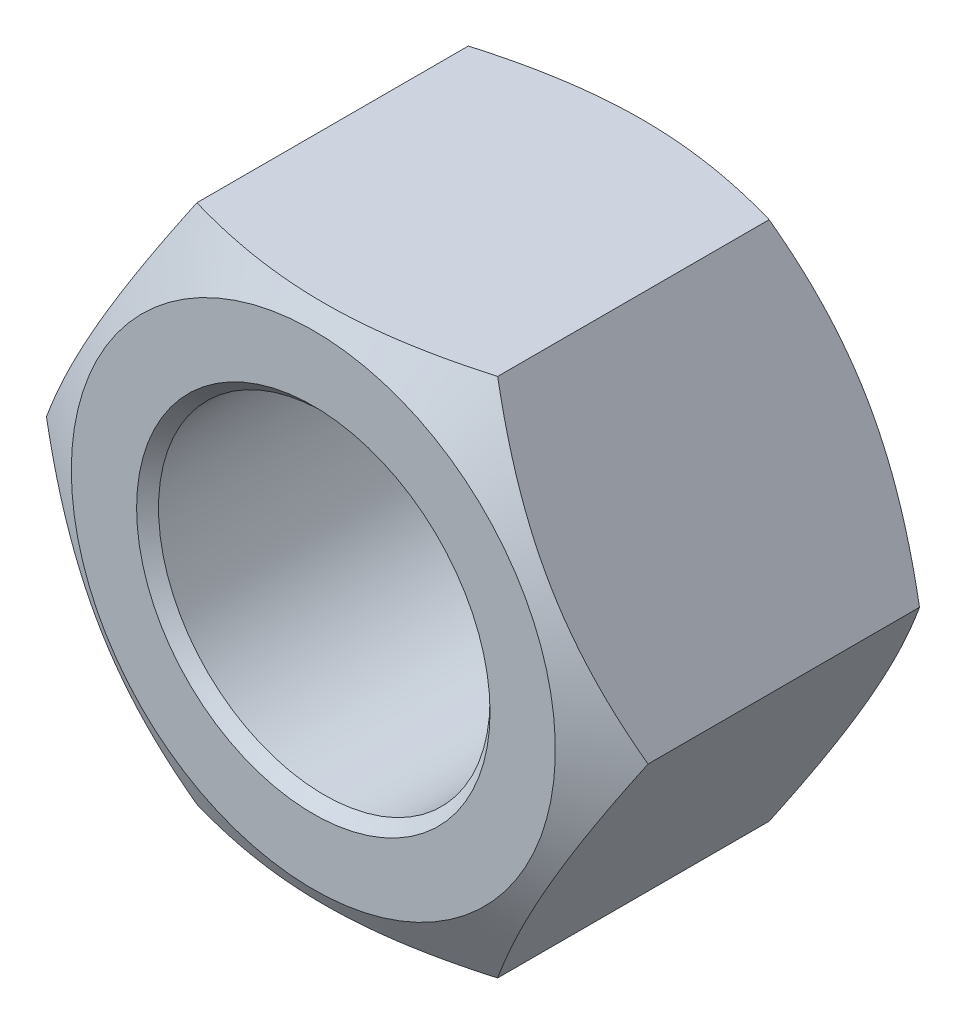
from build123d import *

# Parameters (mm, degrees)
SKETCH1_R        = 17.5
BASENUT_DEPTH    = 34.7
ENDCHAMFER2_SIZE = 1.156666667


with BuildPart() as part:
    # Sketch1 → BaseNut (new body)
    with BuildSketch(Plane.XY):
        Polygon((15.877132403, -27.5), (31.754264805, 0), (15.877132403, 27.5), (-15.877132403, 27.5), (-31.754264805, 0), (-15.877132403, -27.5), align=None)
        Circle(SKETCH1_R, mode=Mode.SUBTRACT)
    extrude(amount=-BASENUT_DEPTH)

    # Sketch2 → Chamfer1 (revolve, cut)
    with BuildSketch(Plane(origin=(15.04811501, 0, -16.706149795), x_dir=(0, 0, -1), z_dir=(0, 1, 0))):
        Polygon((15.537649274, 46.802379815), (17.993850205, 42.54811501), (17.993850205, 46.802379815), align=None)
    revolve(axis=Axis((0, 0, 7.016501752), (0, 0, -1)), mode=Mode.SUBTRACT)

    # Sketch6 → EndChamfer1 (revolve, cut)
    with BuildSketch(Plane(origin=(-9.197458863, 0, -10.252541137), x_dir=(0, 0, 1), z_dir=(0, 1, 0))):
        Polygon((-24.447458863, 26.697458863), (-24.447458863, 28.647458863), (-23.321625838, 26.697458863), align=None)
    revolve(axis=Axis((0, 0, 13.104863586), (0, 0, -1)), mode=Mode.SUBTRACT)

    # Sketch5 → Chamfer2 (revolve, cut)
    with BuildSketch(Plane(origin=(-14.793032735, 0, -16.96123207), x_dir=(0, 0, 1), z_dir=(0, 1, 0))):
        Polygon((16.96123207, 40.343032735), (16.96123207, 46.547297541), (13.379198115, 46.547297541), align=None)
    revolve(axis=Axis((0, 0, -39.536013381), (0, 0, 1)), mode=Mode.SUBTRACT)

    # EndChamfer2
    endchamfer2_edges = [part.edges().sort_by_distance(p)[0] for p in [
        (-17.5, 0, 0),
    ]]
    chamfer(endchamfer2_edges, length=ENDCHAMFER2_SIZE)


solid = part.part
